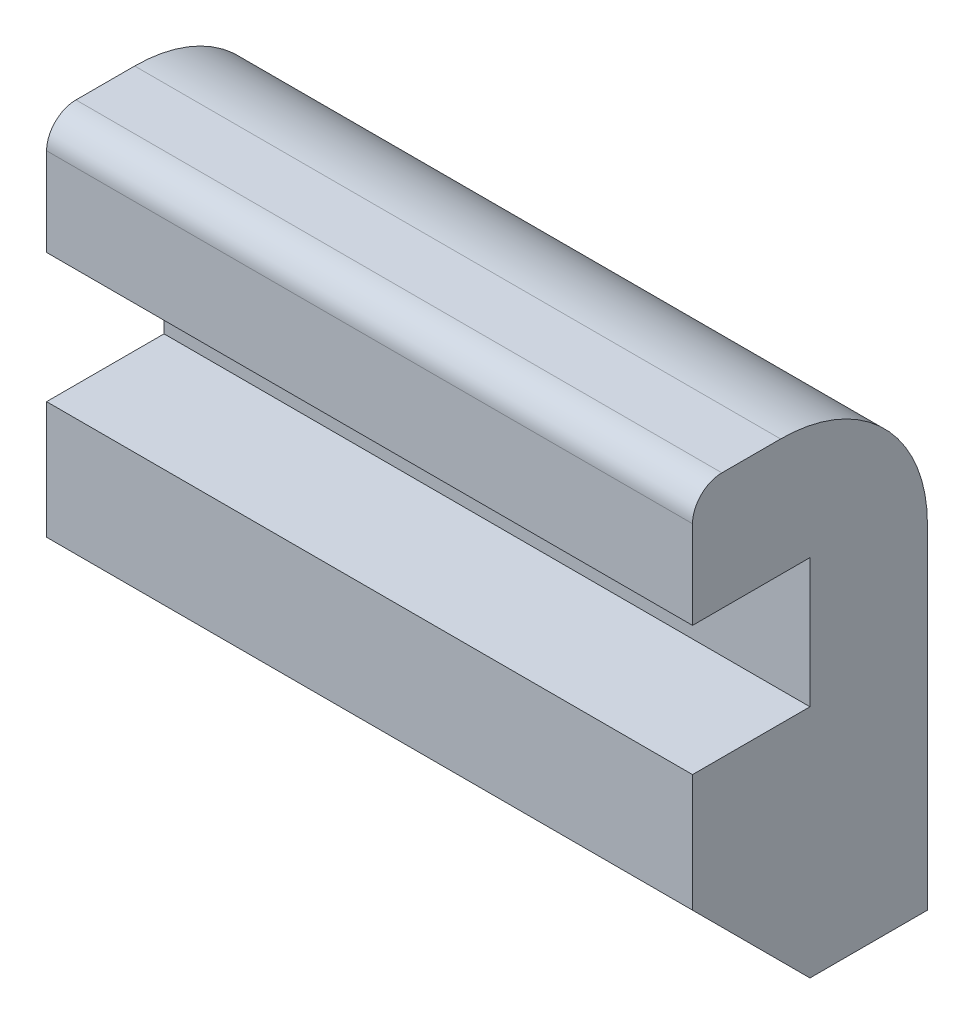
from build123d import *

# Parameters (mm, degrees)
SKETCH1_W                       = 39
SKETCH1_H                       = 155
BOSS_EXTRUDE1_DEPTH             = 2
BOSS_EXTRUDE2_DEPTH             = 38
SKETCH3_W                       = 2
SKETCH3_H                       = 2
BOSS_EXTRUDE3_DEPTH             = 38
SKETCH4_W                       = 2
SKETCH4_H                       = 2
BOSS_EXTRUDE4_DEPTH             = 151
SKETCH6_W                       = 35
SKETCH6_H                       = 2.2
CUT_EXTRUDE1_DEPTH              = 160.340045186
SKETCH7_W                       = 35
SKETCH7_H                       = 2.2
CUT_EXTRUDE2_DEPTH              = 89.490112442
SKETCH5_W                       = 31
SKETCH5_H                       = 2
BOSS_EXTRUDE5_DEPTH             = 2
BOSS_EXTRUDE6_REACH             = 91.367
SKETCH8_W                       = 2
SKETCH8_H                       = 2
BOSS_EXTRUDE6_DIRECTION_2_REACH = 91.367
SKETCH10_W                      = 2
SKETCH10_H                      = 2.2
SKETCH10_W_2                    = 2.2
SKETCH10_H_2                    = 2
BOSS_EXTRUDE8_DEPTH             = 2
SKETCH11_W                      = 2
SKETCH11_H                      = 2.2
SKETCH11_W_2                    = 2.2
SKETCH11_H_2                    = 2
BOSS_EXTRUDE9_DEPTH             = 2
FILLET2_R                       = 2.5
SKETCH14_W                      = 36.5
SKETCH14_H                      = 7.75
BOSS_EXTRUDE10_DEPTH            = 2
SKETCH13_W                      = 31
SKETCH13_H                      = 3
CUT_EXTRUDE4_DEPTH              = 2
FILLET3_R                       = 2
FILLET4_R                       = 0.5
SKETCH15_R                      = 5.1
CUT_EXTRUDE5_DEPTH              = 90.367219941
SKETCH16_R                      = 7.1
BOSS_EXTRUDE11_DEPTH            = 1
FILLET5_R                       = 0.5
FILLET7_R                       = 0.5
CUT_EXTRUDE6_DEPTH              = 6
SKETCH18_W                      = 29
SKETCH18_H                      = 3
CUT_EXTRUDE8_DEPTH              = 90.367219986
CUT_EXTRUDE11_DEPTH             = 90.367219986
CUT_EXTRUDE11_DEPTH_BACK        = 90.367219986
SKETCH20_W                      = 5
SKETCH20_H                      = 40
SKETCH21_W                      = 9
SKETCH21_H                      = 31
CUT_EXTRUDE12_DEPTH             = 89.41097217
SKETCH22_W                      = 11
SKETCH22_H                      = 22.8
CUT_EXTRUDE13_DEPTH             = 41.425858061


with BuildPart() as part:
    # Sketch1 → Boss-Extrude1 (new body)
    with BuildSketch(Plane(origin=(0, 0, 0), x_dir=(1, 0, 0), z_dir=(0, 1, 0))):
        Rectangle(SKETCH1_W, SKETCH1_H)
    extrude(amount=BOSS_EXTRUDE1_DEPTH)

    # Sketch2 → Boss-Extrude2 (add)
    with BuildSketch(Plane(origin=(0, 2, 0), x_dir=(1, 0, 0), z_dir=(0, 1, 0))):
        Polygon((-17.5, -77.5), (-17.5, -75.5), (-17.5, 75.5), (17.5, 75.5), (17.5, -75.5), (17.5, -77.5), (19.5, -77.5), (19.5, 77.5), (-19.5, 77.5), (-19.5, -77.5), align=None)
    extrude(amount=BOSS_EXTRUDE2_DEPTH)

    # Sketch3 → Boss-Extrude3 (add)
    with BuildSketch(Plane(origin=(0, 2, 0), x_dir=(1, 0, 0), z_dir=(0, 1, 0))):
        with Locations((-16.5, -76.5)):
            Rectangle(SKETCH3_W, SKETCH3_H)
        with Locations((-16.5, -72.3)):
            Rectangle(SKETCH3_W, SKETCH3_H)
        with Locations((16.5, -76.5)):
            Rectangle(SKETCH3_W, SKETCH3_H)
        with Locations((16.5, -72.3)):
            Rectangle(SKETCH3_W, SKETCH3_H)
    extrude(amount=BOSS_EXTRUDE3_DEPTH)

    # Sketch4 → Boss-Extrude4 (add)
    with BuildSketch(Plane.XY.offset(-75.5)):
        with Locations((-16.5, 39)):
            Rectangle(SKETCH4_W, SKETCH4_H)
        Polygon((-15.5, 33.8), (-17.5, 31.8), (-17.5, 35.8), (-15.5, 35.8), align=None)
        Polygon((15.5, 35.8), (17.5, 35.8), (17.5, 31.8), (15.5, 33.8), align=None)
        with Locations((16.5, 39)):
            Rectangle(SKETCH4_W, SKETCH4_H)
    extrude(amount=BOSS_EXTRUDE4_DEPTH)

    # Sketch6 → Cut-Extrude1 (cut, through all)
    with BuildSketch(Plane.XY.offset(-75.5)):
        with Locations((0, 36.9)):
            Rectangle(SKETCH6_W, SKETCH6_H)
    extrude(amount=CUT_EXTRUDE1_DEPTH, mode=Mode.SUBTRACT)

    # Sketch7 → Cut-Extrude2 (cut, through all)
    with BuildSketch(Plane(origin=(0, 2, 0), x_dir=(1, 0, 0), z_dir=(0, 1, 0))):
        with Locations((0, -74.4)):
            Rectangle(SKETCH7_W, SKETCH7_H)
    extrude(amount=CUT_EXTRUDE2_DEPTH, mode=Mode.SUBTRACT)

    # Sketch5 → Boss-Extrude5 (add)
    with BuildSketch(Plane(origin=(0, 2, 0), x_dir=(1, 0, 0), z_dir=(0, 1, 0))):
        with Locations((0, -76.5)):
            Rectangle(SKETCH5_W, SKETCH5_H)
        with Locations((0, -72.3)):
            Rectangle(SKETCH5_W, SKETCH5_H)
    extrude(amount=BOSS_EXTRUDE5_DEPTH)

    # Boss-Extrude6: up to this face of the body (flat: up to its plane)
    boss_extrude6_end = Plane(part.part.faces().sort_by_distance((17.5, 16.9, -2.1))[0])
    # Sketch8 → Boss-Extrude6 (add, up to the picked face)
    with BuildSketch(Plane(origin=(0, 0, 0), x_dir=(0, 0, -1), z_dir=(1, 0, 0)), mode=Mode.PRIVATE) as boss_extrude6_sk1:
        with Locations((74.5, 39)):
            Rectangle(SKETCH8_W, SKETCH8_H)
    boss_extrude6_tool1 = split(extrude(boss_extrude6_sk1.sketch, amount=BOSS_EXTRUDE6_REACH, mode=Mode.PRIVATE), bisect_by=boss_extrude6_end, keep=Keep.BOTH, mode=Mode.PRIVATE)
    # Sketch8 → Boss-Extrude6 (add, up to the picked face)
    with BuildSketch(Plane(origin=(0, 0, 0), x_dir=(0, 0, -1), z_dir=(1, 0, 0)), mode=Mode.PRIVATE) as boss_extrude6_sk2:
        Polygon((75.5, 35.8), (73.5, 35.8), (73.5, 33.8), (75.5, 31.8), align=None)
    boss_extrude6_tool2 = split(extrude(boss_extrude6_sk2.sketch, amount=BOSS_EXTRUDE6_REACH, mode=Mode.PRIVATE), bisect_by=boss_extrude6_end, keep=Keep.BOTH, mode=Mode.PRIVATE)
    add(boss_extrude6_tool1.solids().sort_by(Axis((0, 39, -74.5), (1, 0, 0)))[0])
    add(boss_extrude6_tool2.solids().sort_by(Axis((0, 34.244444, -74.611111), (1, 0, 0)))[0])

    # Boss-Extrude6 direction 2: up to this face of the body (flat: up to its plane)
    boss_extrude6_direction_2_end = Plane(part.part.faces().sort_by_distance((-17.5, 16.9, -2.1))[0])
    # Sketch8 → Boss-Extrude6 direction 2 (add, up to the picked face)
    with BuildSketch(Plane(origin=(0, 0, 0), x_dir=(0, 0, -1), z_dir=(1, 0, 0)), mode=Mode.PRIVATE) as boss_extrude6_direction_2_sk1:
        with Locations((74.5, 39)):
            Rectangle(SKETCH8_W, SKETCH8_H)
    boss_extrude6_direction_2_tool1 = split(extrude(boss_extrude6_direction_2_sk1.sketch, amount=-BOSS_EXTRUDE6_DIRECTION_2_REACH, mode=Mode.PRIVATE), bisect_by=boss_extrude6_direction_2_end, keep=Keep.BOTH, mode=Mode.PRIVATE)
    # Sketch8 → Boss-Extrude6 direction 2 (add, up to the picked face)
    with BuildSketch(Plane(origin=(0, 0, 0), x_dir=(0, 0, -1), z_dir=(1, 0, 0)), mode=Mode.PRIVATE) as boss_extrude6_direction_2_sk2:
        Polygon((75.5, 35.8), (73.5, 35.8), (73.5, 33.8), (75.5, 31.8), align=None)
    boss_extrude6_direction_2_tool2 = split(extrude(boss_extrude6_direction_2_sk2.sketch, amount=-BOSS_EXTRUDE6_DIRECTION_2_REACH, mode=Mode.PRIVATE), bisect_by=boss_extrude6_direction_2_end, keep=Keep.BOTH, mode=Mode.PRIVATE)
    add(boss_extrude6_direction_2_tool1.solids().sort_by(Axis((0, 39, -74.5), (-1, 0, 0)))[0])
    add(boss_extrude6_direction_2_tool2.solids().sort_by(Axis((0, 34.244444, -74.611111), (-1, 0, 0)))[0])

    # Sketch10 → Boss-Extrude8 (add)
    with BuildSketch(Plane(origin=(-17.5, 0, 0), x_dir=(0, 0, -1), z_dir=(1, 0, 0))):
        with Locations((-76.5, 36.9)):
            Rectangle(SKETCH10_W, SKETCH10_H)
        with Locations((-74.4, 39)):
            Rectangle(SKETCH10_W_2, SKETCH10_H_2)
    extrude(amount=BOSS_EXTRUDE8_DEPTH)

    # Sketch11 → Boss-Extrude9 (add)
    with BuildSketch(Plane.ZY.offset(-17.5)):
        with Locations((76.5, 36.9)):
            Rectangle(SKETCH11_W, SKETCH11_H)
        with Locations((74.4, 39)):
            Rectangle(SKETCH11_W_2, SKETCH11_H_2)
    extrude(amount=BOSS_EXTRUDE9_DEPTH)

    # Fillet2
    fillet2_edges = [part.edges().sort_by_distance(p)[0] for p in [
        (-17.5, 16.9, 71.3),
        (17.5, 16.9, 71.3),
        (19.5, 20, 77.5),
        (-19.5, 20, 77.5),
        (-19.5, 20, -77.5),
        (-17.5, 16.9, -75.5),
        (17.5, 16.9, -75.5),
        (19.5, 20, -77.5),
        (19.5, 40, 0),
        (-19.5, 40, 0),
        (19.5, 0, 0),
        (-19.5, 0, 0),
        (0, 40, -77.5),
        (0, 0, 77.5),
        (0, 0, -77.5),
        (-17.5, 40, 77.5),
        (17.5, 40, 77.5),
    ]]
    fillet(fillet2_edges, radius=FILLET2_R)

    # Sketch14 → Boss-Extrude10 (add)
    with BuildSketch(Plane.XY.offset(-75.5)):
        with Locations((0, 5.125)):
            Rectangle(SKETCH14_W, SKETCH14_H)
    extrude(amount=BOSS_EXTRUDE10_DEPTH)

    # Sketch13 → Cut-Extrude4 (cut)
    with BuildSketch(Plane(origin=(0, 0, -77.5), x_dir=(-1, 0, 0), z_dir=(0, 0, -1))):
        with Locations((0, 5.5)):
            Rectangle(SKETCH13_W, SKETCH13_H)
    extrude(amount=-CUT_EXTRUDE4_DEPTH, mode=Mode.SUBTRACT)

    # Fillet3
    fillet3_edges = [part.edges().sort_by_distance(p)[0] for p in [
        (0, 9, -73.5),
    ]]
    fillet(fillet3_edges, radius=FILLET3_R - 0.0001)  # a hair under: the kernel refuses the full size

    # Fillet4
    fillet4_edges = [part.edges().sort_by_distance(p)[0] for p in [
        (15.5, 5.5, -75.5),
        (15.5, 4, -76.5),
        (0, 7, -75.5),
        (15.5, 7, -76.5),
        (-15.5, 5.5, -75.5),
        (-15.5, 7, -76.5),
        (0, 4, -75.5),
        (-15.5, 4, -76.5),
        (15.5, 5.5, -77.5),
        (0, 4, -77.5),
        (-15.5, 5.5, -77.5),
        (0, 7, -77.5),
    ]]
    fillet(fillet4_edges, radius=FILLET4_R)

    # Sketch15 → Cut-Extrude5 (cut, through all)
    with BuildSketch(Plane.XZ):
        with Locations(Location((0, 38.75, 0), (0, 0, 270))):
            Circle(SKETCH15_R)
        with Locations(Location((0, -38.75, 0), (0, 0, 270))):
            Circle(SKETCH15_R)
    extrude(amount=-CUT_EXTRUDE5_DEPTH, mode=Mode.SUBTRACT)

    # Sketch16 → Boss-Extrude11 (add)
    with BuildSketch(Plane(origin=(0, 2, 0), x_dir=(1, 0, 0), z_dir=(0, 1, 0))):
        with Locations(Location((0, 38.75, 0), (0, 0, 270))):
            Circle(SKETCH16_R)
        with Locations(Location((0, -38.75, 0), (0, 0, 270))):
            Circle(SKETCH16_R)
    extrude(amount=BOSS_EXTRUDE11_DEPTH)

    # Fillet5
    fillet5_edges = [part.edges().sort_by_distance(p)[0] for p in [
        (0, 2, -45.85),
        (0, 3, -45.85),
        (0, 2, 31.65),
        (0, 3, 31.65),
    ]]
    fillet(fillet5_edges, radius=FILLET5_R - 0.0001)  # a hair under: the kernel refuses the full size

    # Fillet7
    fillet7_edges = [part.edges().sort_by_distance(p)[0] for p in [
        (15.5, 40, 0.75),
        (0, 4, 77.5),
        (0, 40, -73.5),
        (-15.5, 40, 0.75),
        (-15.5, 20.75, 77.5),
        (-15.5, 39.267766953, 76.767766953),
        (15.5, 20.75, 77.5),
        (15.5, 39.267766953, 76.767766953),
    ]]
    fillet(fillet7_edges, radius=FILLET7_R)

    # Sketch17 → Cut-Extrude6 (cut)
    with BuildSketch(Plane.XZ):
        Polygon((-17, -77.5), (-17, 70.299999999), (-14.999999999, 71.3), (-14.999999999, 77.5), (14.999999999, 77.5), (14.999999999, 71.3), (17, 70.299999999), (17, -77.5), align=None)
    extrude(amount=-CUT_EXTRUDE6_DEPTH, mode=Mode.SUBTRACT)

    # Sketch18 → Cut-Extrude8 (cut, through all)
    with BuildSketch(Plane.XY):
        with Locations((0, 7.5)):
            Rectangle(SKETCH18_W, SKETCH18_H)
    extrude(amount=-CUT_EXTRUDE8_DEPTH, mode=Mode.SUBTRACT)

    # Sketch20 → Cut-Extrude11 (cut, two sides: drawn at the far end of the back side and taken through both)
    with BuildSketch(Plane.XY.offset(-CUT_EXTRUDE11_DEPTH_BACK)):
        Polygon((19.5, 40), (14.5, 40), (14.5, 6), (14.5, 0), (19.5, 0), align=None)
        with Locations((-17, 20)):
            Rectangle(SKETCH20_W, SKETCH20_H)
    extrude(amount=CUT_EXTRUDE11_DEPTH + CUT_EXTRUDE11_DEPTH_BACK, mode=Mode.SUBTRACT)

    # Sketch21 → Cut-Extrude12 (cut, through all)
    with BuildSketch(Plane.XY):
        with Locations((-10, 24.5)):
            Rectangle(SKETCH21_W, SKETCH21_H)
        with Locations((10, 24.5)):
            Rectangle(SKETCH21_W, SKETCH21_H)
    extrude(amount=-CUT_EXTRUDE12_DEPTH, mode=Mode.SUBTRACT)

    # Sketch22 → Cut-Extrude13 (cut, through all)
    with BuildSketch(Plane.XY.offset(-75.5)):
        with Locations((0, 20.4)):
            Rectangle(SKETCH22_W, SKETCH22_H)
    extrude(amount=-CUT_EXTRUDE13_DEPTH, mode=Mode.SUBTRACT)


solid = part.part
